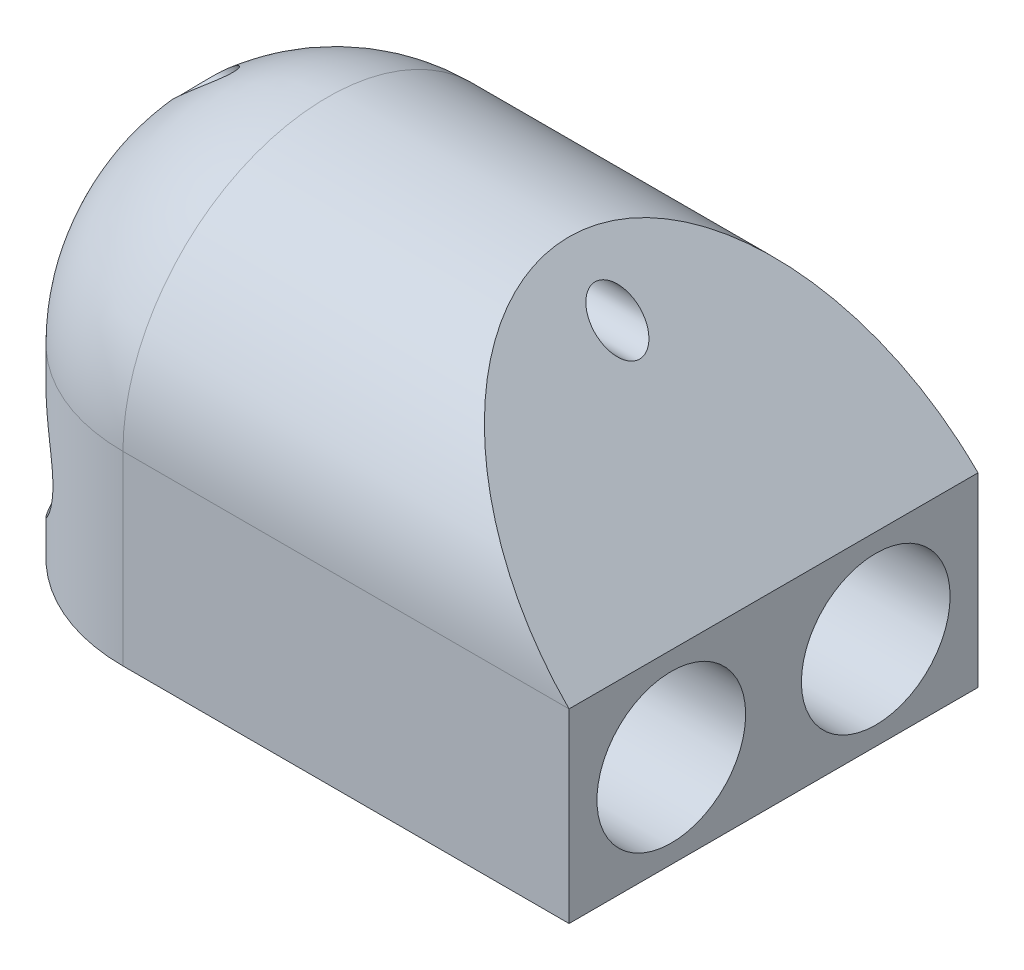
from build123d import *

# Parameters (mm, degrees)
SKETCH1_W              = 21.59
SKETCH1_H              = 13.97
DEPTH_A_DEPTH          = 6.35
ROUND_EXTRUDE_DEPTH    = 21.59
ANGLE_CUT_DEPTH        = 29.967416609
STRING_HOLE_R          = 0.762
STRING_HOLE_CUT_DEPTH  = 29.967416609
ELASTIC_HOLES_R        = 2.54
ELASTIC_HOLE_CUT_DEPTH = 29.967416609
FILLET1_R              = 6.35


with BuildPart() as part:
    # Sketch1 → depth a (new body)
    with BuildSketch(Plane(origin=(0, 0, 0), x_dir=(1, 0, 0), z_dir=(0, 1, 0))):
        with Locations((-10.795, 6.985)):
            Rectangle(SKETCH1_W, SKETCH1_H)
    extrude(amount=DEPTH_A_DEPTH)

    # Sketch4 → round extrude (add)
    with BuildSketch(Plane(origin=(0, 0, 0), x_dir=(0, 0, -1), z_dir=(1, 0, 0))):
        with BuildLine():
            Line((0, 6.35), (13.97, 6.35))
            ThreePointArc((13.97, 6.35), (6.985, 13.335), (0, 6.35))
        make_face()
    extrude(amount=-ROUND_EXTRUDE_DEPTH)

    # Sketch5 → angle cut (cut, through all)
    with BuildSketch(Plane.XY):
        Polygon((0, 6.35), (0, 13.335), (-6.985, 13.335), align=None)
    extrude(amount=-ANGLE_CUT_DEPTH, mode=Mode.SUBTRACT)

    # string hole → string hole cut (cut, through all)
    with BuildSketch(Plane(origin=(0, 0, 0), x_dir=(0, 0, -1), z_dir=(1, 0, 0))):
        with Locations((6.985, 11.684)):
            Circle(STRING_HOLE_R)
    extrude(amount=-STRING_HOLE_CUT_DEPTH, mode=Mode.SUBTRACT)

    # elastic holes → elastic hole cut (cut, through all)
    with BuildSketch(Plane(origin=(0, 0, 0), x_dir=(0, 0, -1), z_dir=(1, 0, 0))):
        with Locations((3.4925, 3.175)):
            Circle(ELASTIC_HOLES_R)
        with Locations(Location((10.4775, 3.175, 0), (0, 0, 180))):
            Circle(ELASTIC_HOLES_R)
    extrude(amount=-ELASTIC_HOLE_CUT_DEPTH, mode=Mode.SUBTRACT)

    # Fillet1
    # the kernel refuses this fillet: 6.35 mm, written as the material it takes off along each edge
    with BuildSketch(Plane(origin=(-21.59, 6.35, -6.985), x_dir=(0, 0, -1), z_dir=(0, -1, 0))) as fillet1_piece_1:
        with BuildLine():
            CenterArc((6.985 - FILLET1_R, FILLET1_R), FILLET1_R, 270, 90)
            Line((6.985, FILLET1_R), (6.985, 0))
            Line((6.985, 0), (6.985 - FILLET1_R, 0))
        make_face()
    revolve(axis=Axis((-21.59, 6.35, -6.985), (1, 0, 0)), revolution_arc=180, mode=Mode.SUBTRACT)
    with BuildSketch(Plane(origin=(-21.59, -15.875, 0), x_dir=(1, 0, 0), z_dir=(0, 1, 0)), Plane(origin=(-21.59, -15.875, -13.97), x_dir=(0, 0, 1), z_dir=(0, 1, 0))) as fillet1_piece_2:
        with BuildLine():
            CenterArc((FILLET1_R, FILLET1_R), FILLET1_R, 180, 90)
            Line((0, FILLET1_R), (0, 0))
            Line((0, 0), (FILLET1_R, 0))
        make_face()
    extrude(amount=22.225, mode=Mode.SUBTRACT)


solid = part.part
